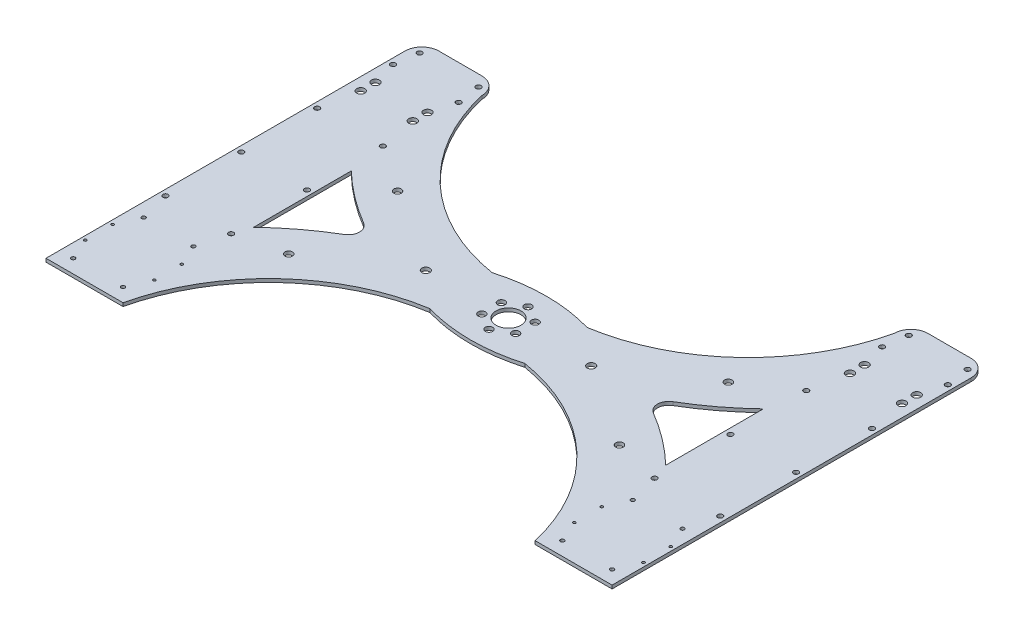
from build123d import *

# Parameters (mm, degrees)
SKETCH1_R           = 6.35
SKETCH1_R_2         = 11
BOSS_EXTRUDE1_DEPTH = 3
SKETCH3_W           = 515.59682947
SKETCH3_H           = 41.835114591
SKETCH3_H_2         = 39.78804392
CUT_EXTRUDE1_DEPTH  = 4
BOSS_EXTRUDE2_DEPTH = 3
BOSS_EXTRUDE3_DEPTH = 3
FILLET3_R           = 15
SKETCH13_R          = 1.2
SKETCH13_R_2        = 2.25
CUT_EXTRUDE2_DEPTH  = 10
SKETCH14_R          = 1.7
CUT_EXTRUDE3_DEPTH  = 10
BOSS_EXTRUDE5_START = -3
SKETCH16_R          = 6.35
BOSS_EXTRUDE5_DEPTH = 3
SKETCH17_R          = 2.5
CUT_EXTRUDE4_DEPTH  = 10
SKETCH18_R          = 6.35
BOSS_EXTRUDE6_DEPTH = 3
SKETCH19_R          = 3.3
CUT_EXTRUDE5_DEPTH  = 10
SKETCH20_R          = 3.55
CUT_EXTRUDE6_DEPTH  = 50
SKETCH21_R          = 3.5
CUT_EXTRUDE7_DEPTH  = 50
BOSS_EXTRUDE7_START = -3
SKETCH22_R          = 2.5
BOSS_EXTRUDE7_DEPTH = 3
SKETCH23_R          = 3.25
CUT_EXTRUDE8_DEPTH  = 3


with BuildPart() as part:
    # Sketch1 → Boss-Extrude1 (new body)
    with BuildSketch(Plane(origin=(0, 0, 0), x_dir=(1, 0, 0), z_dir=(0, 1, 0))):
        with BuildLine():
            ThreePointArc((-41.906019658, -27.5), (-137.644967441, -71.462113616), (-197, -158.5))
            ThreePointArc((-197, -158.5), (-223.5, -185), (-250, -158.5))
            ThreePointArc((-250, -158.5), (-208.03231281, -72.364423731), (-136.504816256, -8.61145122))
            ThreePointArc((-136.504816256, -8.61145122), (-131.588408281, 0), (-136.504816256, 8.61145122))
            ThreePointArc((-136.504816256, 8.61145122), (-208.03231281, 72.364423731), (-250, 158.5))
            ThreePointArc((-250, 158.5), (-223.5, 185), (-197, 158.5))
            ThreePointArc((-197, 158.5), (-137.644967441, 71.462113616), (-41.906019658, 27.5))
            ThreePointArc((-41.906019658, 27.5), (0, 33.5), (41.906019658, 27.5))
            ThreePointArc((41.906019658, 27.5), (137.644967441, 71.462113616), (197, 158.5))
            ThreePointArc((197, 158.5), (223.5, 185), (250, 158.5))
            ThreePointArc((250, 158.5), (208.03231281, 72.364423731), (136.504816256, 8.61145122))
            ThreePointArc((136.504816256, 8.61145122), (131.588408281, 0), (136.504816256, -8.61145122))
            ThreePointArc((136.504816256, -8.61145122), (208.03231281, -72.364423731), (250, -158.5))
            ThreePointArc((250, -158.5), (223.5, -185), (197, -158.5))
            ThreePointArc((197, -158.5), (137.644967441, -71.462113616), (41.906019658, -27.5))
            ThreePointArc((41.906019658, -27.5), (0, -33.5), (-41.906019658, -27.5))
        make_face()
        with Locations(Location((39.6, 0, 0), (0, 0, 270))):
            Circle(SKETCH1_R, mode=Mode.SUBTRACT)
        with Locations(Location((-39.6, 0, 0), (0, 0, 90))):
            Circle(SKETCH1_R, mode=Mode.SUBTRACT)
        with Locations(Location((0, 0, 0), (0, 0, 270))):
            Circle(SKETCH1_R_2, mode=Mode.SUBTRACT)
    extrude(amount=BOSS_EXTRUDE1_DEPTH)

    # Sketch3 → Cut-Extrude1 (cut)
    with BuildSketch(Plane(origin=(0, 3, 0), x_dir=(1, 0, 0), z_dir=(0, 1, 0))):
        with Locations((7.798414735, 179.417557295)):
            Rectangle(SKETCH3_W, SKETCH3_H)
        with Locations((7.798414735, -178.39402196)):
            Rectangle(SKETCH3_W, SKETCH3_H_2)
    extrude(amount=-CUT_EXTRUDE1_DEPTH, mode=Mode.SUBTRACT)

    # Sketch8 → Boss-Extrude2 (add)
    with BuildSketch(Plane.XZ):
        with BuildLine():
            Line((-250, -158.5), (-250, 158.5))
            ThreePointArc((-250, 158.5), (-223.949910555, 96.121754218), (-182, 43.113663219))
            Line((-182, 43.113663219), (-182, -43.113663219))
            ThreePointArc((-182, -43.113663219), (-223.949910555, -96.121754218), (-250, -158.5))
        make_face()
        with BuildLine():
            Line((-197, -158.5), (-182, -158.5))
            ThreePointArc((-182, -158.5), (-131.938879854, -71.626716928), (-41.906019658, -27.5))
            ThreePointArc((-41.906019658, -27.5), (-137.644967441, -71.462113616), (-197, -158.5))
        make_face()
        with BuildLine():
            Line((250, -158.5), (250, 158.5))
            ThreePointArc((250, 158.5), (223.949910555, 96.121754218), (182, 43.113663219))
            Line((182, 43.113663219), (182, -43.113663219))
            ThreePointArc((182, -43.113663219), (223.949910555, -96.121754218), (250, -158.5))
        make_face()
        with BuildLine():
            Line((-197, 158.5), (-182, 158.5))
            ThreePointArc((-182, 158.5), (-131.938879854, 71.626716928), (-41.906019658, 27.5))
            ThreePointArc((-41.906019658, 27.5), (-137.644967441, 71.462113616), (-197, 158.5))
        make_face()
        with BuildLine():
            Line((197, 158.5), (182, 158.5))
            ThreePointArc((182, 158.5), (131.938879854, 71.626716928), (41.906019658, 27.5))
            ThreePointArc((41.906019658, 27.5), (137.644967441, 71.462113616), (197, 158.5))
        make_face()
        with BuildLine():
            Line((197, -158.5), (182, -158.5))
            ThreePointArc((182, -158.5), (131.938879854, -71.626716928), (41.906019658, -27.5))
            ThreePointArc((41.906019658, -27.5), (137.644967441, -71.462113616), (197, -158.5))
        make_face()
    extrude(amount=-BOSS_EXTRUDE2_DEPTH)

    # Sketch11 → Boss-Extrude3 (add)
    with BuildSketch(Plane(origin=(0, 3, 0), x_dir=(1, 0, 0), z_dir=(0, 1, 0))):
        Polygon((250, 158.5), (250, 173.5), (184.763828731, 173.5), (182, 173.5), (182, 158.5), align=None)
        Polygon((-182, 173.5), (-184.763828731, 173.5), (-250, 173.5), (-250, 158.5), (-182, 158.5), align=None)
    extrude(amount=-BOSS_EXTRUDE3_DEPTH)

    # Fillet3
    fillet3_edges = [part.edges().sort_by_distance(p)[0] for p in [
        (250, 1.5, -173.5),
        (182, 1.5, -173.5),
        (-182, 1.5, -173.5),
        (-250, 1.5, -173.5),
    ]]
    fillet(fillet3_edges, radius=FILLET3_R - 0.0001)  # a hair under: the kernel refuses the full size

    # Sketch13 → Cut-Extrude2 (cut)
    with BuildSketch(Plane(origin=(0, 3, 0), x_dir=(1, 0, 0), z_dir=(0, 1, 0))):
        with Locations(Location((-185.5, -127.333333333, 0), (0, 0, 270))):
            Circle(SKETCH13_R)
        with Locations(Location((-185.5, -103.166666667, 0), (0, 0, 270))):
            Circle(SKETCH13_R)
        with Locations(Location((-246.5, -103.166666667, 0), (0, 0, 270))):
            Circle(SKETCH13_R)
        with Locations(Location((-246.5, -127.333333333, 0), (0, 0, 270))):
            Circle(SKETCH13_R)
        with Locations(Location((-187, -58, 0), (0, 0, 270))):
            Circle(SKETCH13_R_2)
        with Locations(Location((-187, 9, 0), (0, 0, 270))):
            Circle(SKETCH13_R_2)
        with Locations(Location((-187, 76, 0), (0, 0, 270))):
            Circle(SKETCH13_R_2)
        with Locations(Location((-187, 143, 0), (0, 0, 270))):
            Circle(SKETCH13_R_2)
        with Locations(Location((-245, 143, 0), (0, 0, 270))):
            Circle(SKETCH13_R_2)
        with Locations(Location((-245, 76, 0), (0, 0, 270))):
            Circle(SKETCH13_R_2)
        with Locations(Location((-245, 9, 0), (0, 0, 270))):
            Circle(SKETCH13_R_2)
        with Locations(Location((-245, -58, 0), (0, 0, 270))):
            Circle(SKETCH13_R_2)
        with Locations(Location((-242, 163.5, 0), (0, 0, 270))):
            Circle(SKETCH13_R_2)
        with Locations(Location((-190, 163.5, 0), (0, 0, 270))):
            Circle(SKETCH13_R_2)
    cut_extrude2 = extrude(amount=-CUT_EXTRUDE2_DEPTH, mode=Mode.SUBTRACT)

    # Sketch14 → Cut-Extrude3 (cut)
    with BuildSketch(Plane(origin=(0, 3, 0), x_dir=(1, 0, 0), z_dir=(0, 1, 0))):
        with Locations(Location((-194, -146.5, 0), (0, 0, 270))):
            Circle(SKETCH14_R)
        with Locations(Location((-238, -146.5, 0), (0, 0, 270))):
            Circle(SKETCH14_R)
        with Locations(Location((-194, -84.3, 0), (0, 0, 270))):
            Circle(SKETCH14_R)
        with Locations(Location((-238, -84.3, 0), (0, 0, 270))):
            Circle(SKETCH14_R)
    cut_extrude3 = extrude(amount=-CUT_EXTRUDE3_DEPTH, mode=Mode.SUBTRACT)

    # Mirror4: Cut-Extrude2, Cut-Extrude3 across plane
    add(cut_extrude2.mirror(Plane(origin=(0, 0, 0), x_dir=(0, 0, 1), z_dir=(1, 0, 0))), mode=Mode.SUBTRACT)
    add(cut_extrude3.mirror(Plane(origin=(0, 0, 0), x_dir=(0, 0, 1), z_dir=(1, 0, 0))), mode=Mode.SUBTRACT)

    # Sketch16 → Boss-Extrude5 (add)
    with BuildSketch(Plane(origin=(0, 3, 0), x_dir=(1, 0, 0), z_dir=(0, 1, 0)).offset(BOSS_EXTRUDE5_START)):
        with Locations((-39.6, 0)):
            Circle(SKETCH16_R)
        with Locations((39.6, 0)):
            Circle(SKETCH16_R)
    extrude(amount=BOSS_EXTRUDE5_DEPTH)

    # Sketch17 → Cut-Extrude4 (cut)
    with BuildSketch(Plane(origin=(0, 3, 0), x_dir=(1, 0, 0), z_dir=(0, 1, 0))):
        with Locations(Location((0, 19, 0), (0, 0, 270))):
            Circle(SKETCH17_R)
        with Locations(Location((19, 0, 0), (0, 0, 270))):
            Circle(SKETCH17_R)
        with Locations(Location((0, -19, 0), (0, 0, 270))):
            Circle(SKETCH17_R)
        with Locations(Location((-19, 0, 0), (0, 0, 270))):
            Circle(SKETCH17_R)
    extrude(amount=-CUT_EXTRUDE4_DEPTH, mode=Mode.SUBTRACT)

    # Sketch18 → Boss-Extrude6 (add)
    with BuildSketch(Plane.XZ):
        with Locations((-39.6, 0)):
            Circle(SKETCH18_R)
        with Locations((39.6, 0)):
            Circle(SKETCH18_R)
    extrude(amount=-BOSS_EXTRUDE6_DEPTH)

    # Sketch19 → Cut-Extrude5 (cut)
    with BuildSketch(Plane.XZ):
        with Locations(Location((-146.094577254, 48.086735474, 0), (0, 0, 270))):
            Circle(SKETCH19_R)
        with Locations(Location((146.094577254, 48.086735474, 0), (0, 0, 270))):
            Circle(SKETCH19_R)
        with Locations(Location((146.094577254, -48.086735474, 0), (0, 0, 270))):
            Circle(SKETCH19_R)
        with Locations(Location((-146.094577254, -48.086735474, 0), (0, 0, 270))):
            Circle(SKETCH19_R)
    extrude(amount=-CUT_EXTRUDE5_DEPTH, mode=Mode.SUBTRACT)

    # Sketch20 → Cut-Extrude6 (cut)
    with BuildSketch(Plane.XZ):
        with Locations(Location((-239.042094399, -108.501069067, 0), (0, 0, 270))):
            Circle(SKETCH20_R)
        with Locations(Location((-239.042094399, -121.501069067, 0), (0, 0, 270))):
            Circle(SKETCH20_R)
        with Locations(Location((-193.042094399, -108.501069067, 0), (0, 0, 270))):
            Circle(SKETCH20_R)
        with Locations(Location((-193.042094399, -121.501069067, 0), (0, 0, 270))):
            Circle(SKETCH20_R)
    cut_extrude6 = extrude(amount=-CUT_EXTRUDE6_DEPTH, mode=Mode.SUBTRACT)

    # Mirror5: Cut-Extrude6 across plane
    add(cut_extrude6.mirror(Plane(origin=(0, 0, 0), x_dir=(0, 0, 1), z_dir=(1, 0, 0))), mode=Mode.SUBTRACT)

    # Sketch21 → Cut-Extrude7 (cut)
    with BuildSketch(Plane.XZ):
        with Locations(Location((-73.049577254, 0, 0), (0, 0, 270))):
            Circle(SKETCH21_R)
    cut_extrude7 = extrude(amount=-CUT_EXTRUDE7_DEPTH, mode=Mode.SUBTRACT)

    # Mirror6: Cut-Extrude7 across plane
    add(cut_extrude7.mirror(Plane(origin=(0, 0, 0), x_dir=(0, 0, 1), z_dir=(1, 0, 0))), mode=Mode.SUBTRACT)

    # Sketch22 → Boss-Extrude7 (add)
    with BuildSketch(Plane.XZ.offset(BOSS_EXTRUDE7_START)):
        with Locations((0, -19)):
            Circle(SKETCH22_R)
        with Locations((-19, 0)):
            Circle(SKETCH22_R)
        with Locations((0, 19)):
            Circle(SKETCH22_R)
        with Locations((19, 0)):
            Circle(SKETCH22_R)
    extrude(amount=BOSS_EXTRUDE7_DEPTH)

    # Sketch23 → Cut-Extrude8 (cut)
    with BuildSketch(Plane.XZ):
        with Locations(Location((0, 17.25, 0), (0, 0, 270))):
            Circle(SKETCH23_R)
        with Locations(Location((14.938938215, 8.625, 0), (0, 0, 270))):
            Circle(SKETCH23_R)
        with Locations(Location((14.938938215, -8.625, 0), (0, 0, 270))):
            Circle(SKETCH23_R)
        with Locations(Location((0, -17.25, 0), (0, 0, 270))):
            Circle(SKETCH23_R)
        with Locations(Location((-14.938938215, -8.625, 0), (0, 0, 270))):
            Circle(SKETCH23_R)
        with Locations(Location((-14.938938215, 8.625, 0), (0, 0, 270))):
            Circle(SKETCH23_R)
    extrude(amount=-CUT_EXTRUDE8_DEPTH, mode=Mode.SUBTRACT)


solid = part.part
